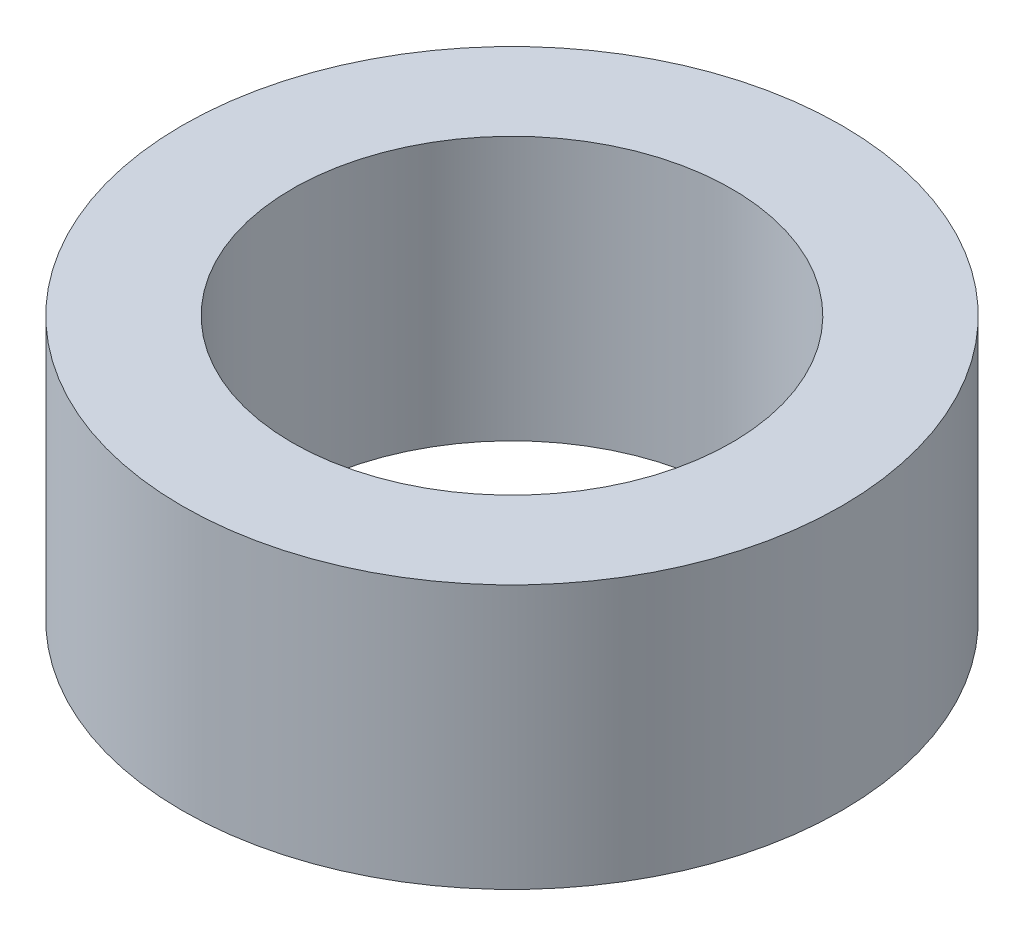
from build123d import *

# Parameters (mm, degrees)
SKETCH1_R           = 30
BOSS_EXTRUDE1_DEPTH = 24
SKETCH2_R           = 20
CUT_EXTRUDE1_DEPTH  = 49.744230428


with BuildPart() as part:
    # Sketch1 → Boss-Extrude1 (new body)
    with BuildSketch(Plane(origin=(0, 0, 0), x_dir=(1, 0, 0), z_dir=(0, 1, 0))):
        Circle(SKETCH1_R)
    extrude(amount=BOSS_EXTRUDE1_DEPTH)

    # Sketch2 → Cut-Extrude1 (cut, through all)
    with BuildSketch(Plane(origin=(0, 0, 0), x_dir=(1, 0, 0), z_dir=(0, 1, 0))):
        Circle(SKETCH2_R)
    extrude(amount=CUT_EXTRUDE1_DEPTH, mode=Mode.SUBTRACT)


solid = part.part
